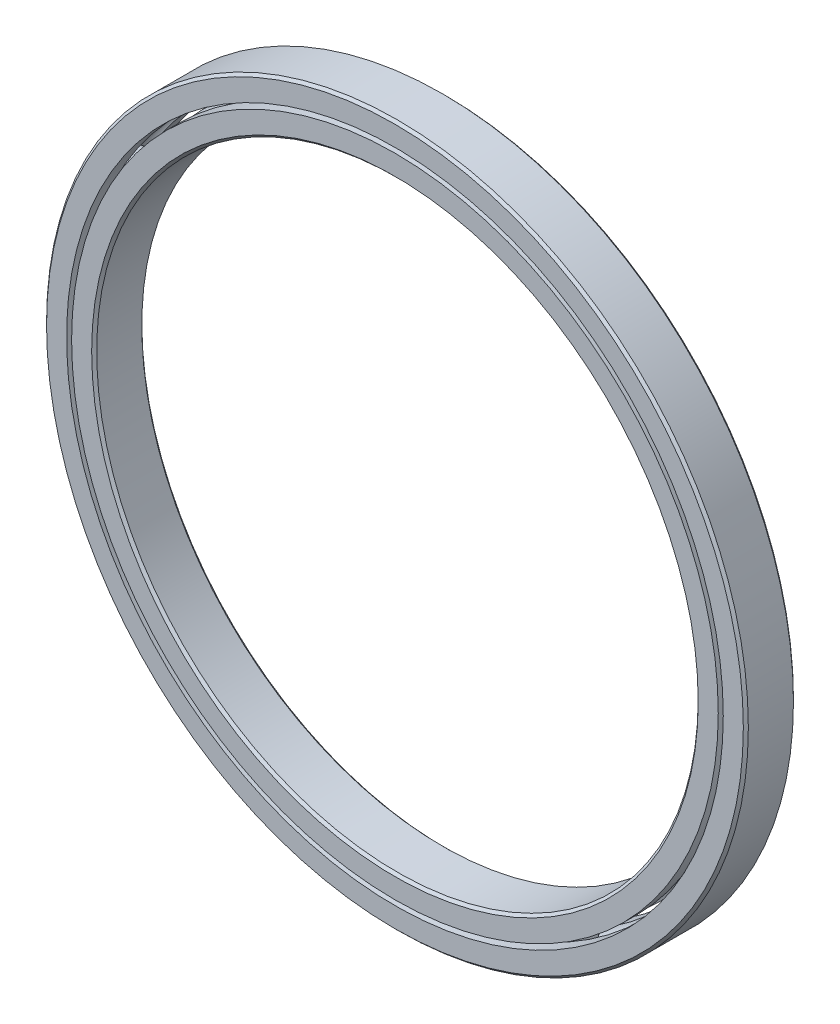
from build123d import *

# Parameters (mm, degrees)
CIRPATTERN1_COUNT = 12


with BuildPart() as part:
    # Sketch1 → Revolve1 (revolve)
    with BuildSketch(Plane(origin=(0, 0, 0), x_dir=(0, 0, -1), z_dir=(1, 0, 0))):
        with BuildLine():
            Line((2.8575, 44.45), (-2.8575, 44.45))
            Line((-2.8575, 44.45), (-3.175, 44.1325))
            Line((-3.175, 44.1325), (-3.175, 41.5925))
            Line((-3.175, 41.5925), (-1.411111111, 41.5925))
            ThreePointArc((-1.411111111, 41.5925), (0, 42.721388889), (1.411111111, 41.5925))
            Line((1.411111111, 41.5925), (3.175, 41.5925))
            Line((3.175, 41.5925), (3.175, 44.1325))
            Line((3.175, 44.1325), (2.8575, 44.45))
        make_face()
    revolve(axis=Axis((0, 0, 3.175), (0, 0, -1)))


with BuildPart() as body_2:
    # Sketch3 → Revolve3 (revolve)
    with BuildSketch(Plane(origin=(0, 0, 0), x_dir=(0, 0, -1), z_dir=(1, 0, 0))):
        with BuildLine():
            Line((-3.175, 40.9575), (-1.411111111, 40.9575))
            ThreePointArc((-1.411111111, 40.9575), (0, 39.828611111), (1.411111111, 40.9575))
            Line((1.411111111, 40.9575), (3.175, 40.9575))
            Line((3.175, 40.9575), (3.175, 38.4175))
            Line((3.175, 38.4175), (2.8575, 38.1))
            Line((2.8575, 38.1), (-2.8575, 38.1))
            Line((-2.8575, 38.1), (-3.175, 38.4175))
            Line((-3.175, 38.4175), (-3.175, 40.9575))
        make_face()
    revolve(axis=Axis((0, 0, 3.175), (0, 0, -1)))


with BuildPart() as body_3:
    # Sketch4 → Revolve4 (revolve)
    with BuildSketch(Plane(origin=(0, 0, 0), x_dir=(0, 0, -1), z_dir=(1, 0, 0))):
        with BuildLine():
            Line((-1.446388889, 41.275), (1.446388889, 41.275))
            ThreePointArc((1.446388889, 41.275), (0, 42.721388889), (-1.446388889, 41.275))
        make_face()
    revolve(axis=Axis((0, 41.275, 1.446388889), (0, 0, -1)))


with BuildPart() as cirpattern1_1:
    # CirPattern1: pattern copy
    add(body_3.part.rotate(Axis((0, 0, -3.175), (0, 0, 1)), 1 * 360 / CIRPATTERN1_COUNT))


with BuildPart() as cirpattern1_2:
    # CirPattern1: pattern copy
    add(body_3.part.rotate(Axis((0, 0, -3.175), (0, 0, 1)), 2 * 360 / CIRPATTERN1_COUNT))


with BuildPart() as cirpattern1_3:
    # CirPattern1: pattern copy
    add(body_3.part.rotate(Axis((0, 0, -3.175), (0, 0, 1)), 3 * 360 / CIRPATTERN1_COUNT))


with BuildPart() as cirpattern1_4:
    # CirPattern1: pattern copy
    add(body_3.part.rotate(Axis((0, 0, -3.175), (0, 0, 1)), 4 * 360 / CIRPATTERN1_COUNT))


with BuildPart() as cirpattern1_5:
    # CirPattern1: pattern copy
    add(body_3.part.rotate(Axis((0, 0, -3.175), (0, 0, 1)), 5 * 360 / CIRPATTERN1_COUNT))


with BuildPart() as cirpattern1_6:
    # CirPattern1: pattern copy
    add(body_3.part.rotate(Axis((0, 0, -3.175), (0, 0, 1)), 6 * 360 / CIRPATTERN1_COUNT))


with BuildPart() as cirpattern1_7:
    # CirPattern1: pattern copy
    add(body_3.part.rotate(Axis((0, 0, -3.175), (0, 0, 1)), 7 * 360 / CIRPATTERN1_COUNT))


with BuildPart() as cirpattern1_8:
    # CirPattern1: pattern copy
    add(body_3.part.rotate(Axis((0, 0, -3.175), (0, 0, 1)), 8 * 360 / CIRPATTERN1_COUNT))


with BuildPart() as cirpattern1_9:
    # CirPattern1: pattern copy
    add(body_3.part.rotate(Axis((0, 0, -3.175), (0, 0, 1)), 9 * 360 / CIRPATTERN1_COUNT))


with BuildPart() as cirpattern1_10:
    # CirPattern1: pattern copy
    add(body_3.part.rotate(Axis((0, 0, -3.175), (0, 0, 1)), 10 * 360 / CIRPATTERN1_COUNT))


with BuildPart() as cirpattern1_11:
    # CirPattern1: pattern copy
    add(body_3.part.rotate(Axis((0, 0, -3.175), (0, 0, 1)), 11 * 360 / CIRPATTERN1_COUNT))


solid = Compound([part.part, body_2.part, body_3.part, cirpattern1_1.part, cirpattern1_2.part, cirpattern1_3.part, cirpattern1_4.part, cirpattern1_5.part, cirpattern1_6.part, cirpattern1_7.part, cirpattern1_8.part, cirpattern1_9.part, cirpattern1_10.part, cirpattern1_11.part])
